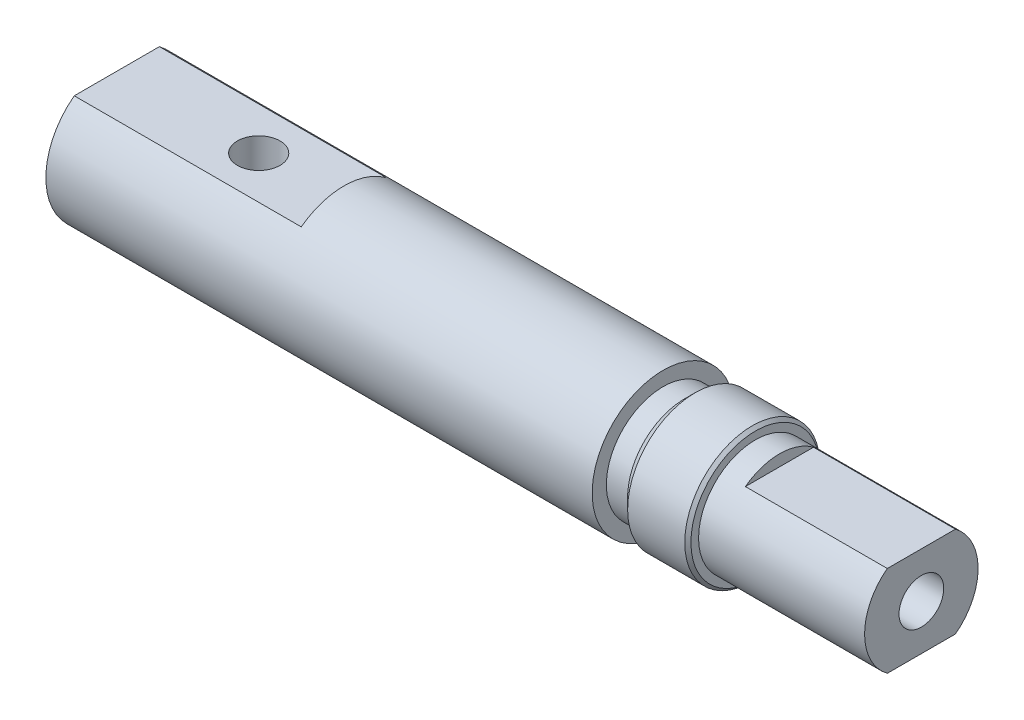
from build123d import *

# Parameters (mm, degrees)
CUT_EXTRUDE1_START               = -16
CUT_EXTRUDE1_DEPTH               = 16
F_3_0MM_DOWEL_HOLE1_D            = 3
CUT_EXTRUDE3_START               = -20
SKETCH17_R                       = 5
SKETCH17_R_2                     = 4
CUT_EXTRUDE3_DEPTH               = 1.5
CHAMFER2_SIZE                    = 1
SKETCH18_R                       = 4
CUT_EXTRUDE4_DEPTH               = 3.3
TAP_DRILL_FOR_M3_HELICOIL1_D     = 3.15
TAP_DRILL_FOR_M3_HELICOIL1_DEPTH = 10
TAP_DRILL_FOR_M3_HELICOIL1_TIP   = 0.946355475
CUT_EXTRUDE5_DEPTH               = 10
SKETCH24_R                       = 5
BOSS_EXTRUDE1_DEPTH              = 3
SKETCH26_R                       = 5
SKETCH26_R_2                     = 4.7565
CUT_EXTRUDE6_DEPTH               = 0.5


# Read off the part's stored shape, not the designer's step: M10x0.75 Machine Threads Stud1
with BuildPart() as part:
    # Sketch1 → Revolve1 (revolve)
    with BuildSketch(Plane.XY, mode=Mode.PRIVATE) as revolve1_sk:
        Polygon((0, 0), (0, 5), (45, 5), (45, 4), (60, 4), (60, 0), align=None)
    revolve(revolve1_sk.sketch.rotate(Axis((0, 0, 0), (1, 0, 0)), 90), axis=Axis((0, 0, 0), (1, 0, 0)))

    # Sketch2 → Cut-Extrude1 (cut)
    with BuildSketch(Plane.ZY.offset(CUT_EXTRUDE1_START)):
        with BuildLine():
            Line((-3, 4), (3, 4))
            ThreePointArc((3, 4), (0, 5), (-3, 4))
        make_face()
        with BuildLine():
            Line((3, -4), (-3, -4))
            ThreePointArc((-3, -4), (0, -5), (3, -4))
        make_face()
    extrude(amount=CUT_EXTRUDE1_DEPTH, mode=Mode.SUBTRACT)

    # Ø3.0mm Dowel Hole1 (through all)
    with Locations(Plane(origin=(0, 4, 0), x_dir=(1, 0, 0), z_dir=(0, 1, 0))):
        with Locations((10, 0)):
            Hole(F_3_0MM_DOWEL_HOLE1_D / 2)

    # Sketch17 → Cut-Extrude3 (cut)
    with BuildSketch(Plane(origin=(60, 0, 0), x_dir=(0, 0, -1), z_dir=(1, 0, 0)).offset(CUT_EXTRUDE3_START)):
        with Locations(Location((0, 0, 0), (0, 0, 180))):
            Circle(SKETCH17_R)
        with Locations(Location((0, 0, 0), (0, 0, 180))):
            Circle(SKETCH17_R_2, mode=Mode.SUBTRACT)
    extrude(amount=-CUT_EXTRUDE3_DEPTH, mode=Mode.SUBTRACT)

    # Chamfer2
    chamfer2_edges = [part.edges().sort_by_distance(p)[0] for p in [
        (40, 0, -5),
        (45, 0, -5),
    ]]
    chamfer(chamfer2_edges, length=CHAMFER2_SIZE - 0.0001)  # a hair under: the kernel refuses the full size

    # Sketch18 → Cut-Extrude4 (cut)
    with BuildSketch(Plane(origin=(60, 0, 0), x_dir=(0, 0, -1), z_dir=(1, 0, 0))):
        with Locations(Location((0, 0, 0), (0, 0, 180))):
            Circle(SKETCH18_R)
    extrude(amount=-CUT_EXTRUDE4_DEPTH, mode=Mode.SUBTRACT)

    # Tap Drill for M3 Helicoil1
    with Locations(Plane(origin=(56.7, 0, 0), x_dir=(0, 0, -1), z_dir=(1, 0, 0))):
        with Locations((0, 0)):
            Hole(TAP_DRILL_FOR_M3_HELICOIL1_D / 2, depth=TAP_DRILL_FOR_M3_HELICOIL1_DEPTH)
            with Locations((0, 0, -(TAP_DRILL_FOR_M3_HELICOIL1_DEPTH + TAP_DRILL_FOR_M3_HELICOIL1_TIP / 2))):  # 118° drill point
                Cone(0, TAP_DRILL_FOR_M3_HELICOIL1_D / 2, TAP_DRILL_FOR_M3_HELICOIL1_TIP, mode=Mode.SUBTRACT)

    # Sketch23 → Cut-Extrude5 (cut)
    with BuildSketch(Plane(origin=(56.7, 0, 0), x_dir=(0, 0, -1), z_dir=(1, 0, 0))):
        with BuildLine():
            ThreePointArc((2.4, 3.2), (0, 4), (-2.4, 3.2))
            Line((-2.4, 3.2), (2.4, 3.2))
        make_face()
        with BuildLine():
            Line((2.4, -3.2), (-2.4, -3.2))
            ThreePointArc((-2.4, -3.2), (0, -4), (2.4, -3.2))
        make_face()
    extrude(amount=-CUT_EXTRUDE5_DEPTH, mode=Mode.SUBTRACT)

    # Sketch24 → Boss-Extrude1 (add)
    with BuildSketch(Plane(origin=(45, 0, 0), x_dir=(0, 0, -1), z_dir=(1, 0, 0))):
        Circle(SKETCH24_R)
    extrude(amount=-BOSS_EXTRUDE1_DEPTH)

    # M10x0.75 Machine Threads Stud1 outline → M10x0.75 Machine Threads Stud1 (revolve, cut)
    with BuildSketch(Plane.YX):
        Polygon((5, 45), (4.54, 45), (4.7565, 44.7835), (4.7565, 41), (5, 41), align=None)
    revolve(axis=Axis((0, 0, 0), (1, 0, 0)), mode=Mode.SUBTRACT)

    # Sketch26 → Cut-Extrude6 (cut)
    with BuildSketch(Plane(origin=(41, 0, 0), x_dir=(0, 0, -1), z_dir=(1, 0, 0))):
        with Locations(Location((0, 0, 0), (0, 0, 126.869897646))):
            Circle(SKETCH26_R)
        with Locations(Location((0, 0, 0), (0, 0, 180))):
            Circle(SKETCH26_R_2, mode=Mode.SUBTRACT)
    extrude(amount=-CUT_EXTRUDE6_DEPTH, mode=Mode.SUBTRACT)


solid = part.part
